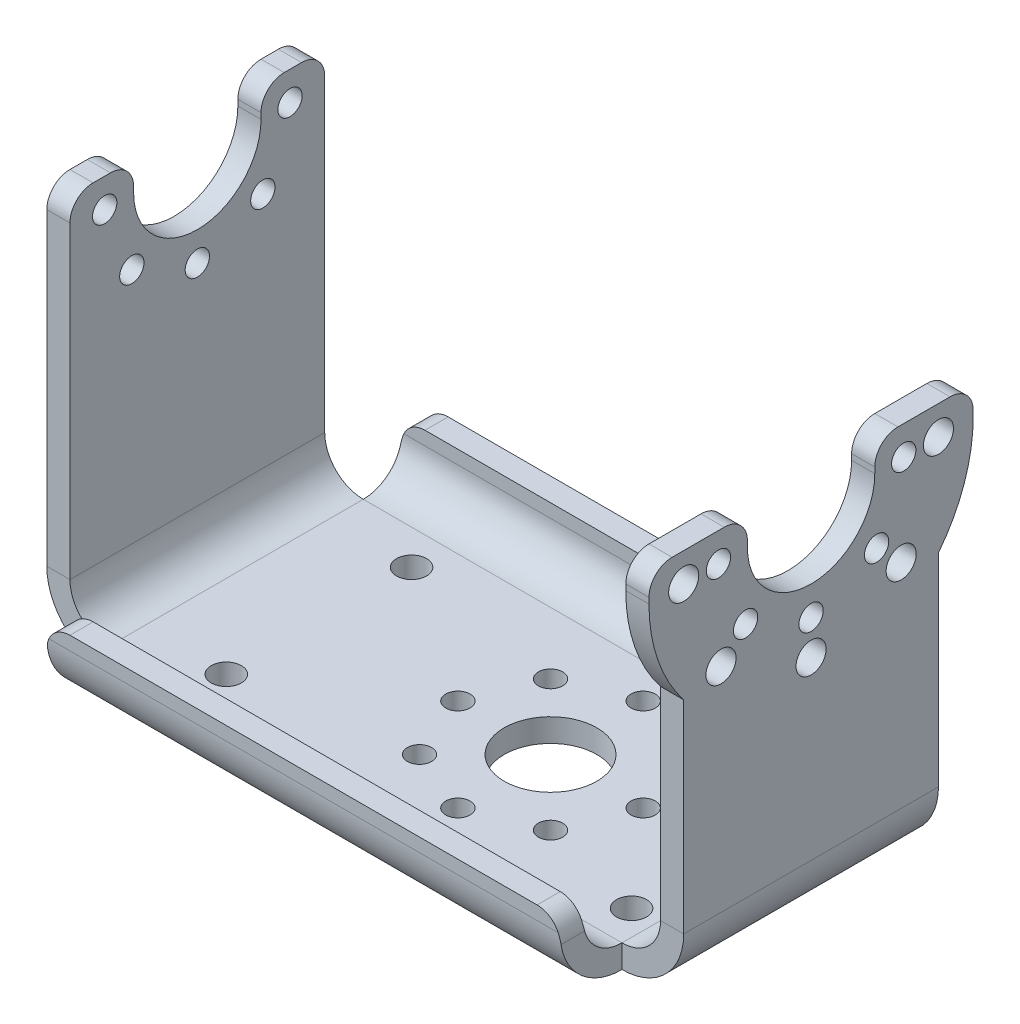
from build123d import *

# Parameters (mm, degrees)
BASE_FLANGE1_DEPTH      = 11
SKETCH5_R               = 4
SKETCH5_R_2             = 1.3
SKETCH5_R_3             = 1.05
CUT_EXTRUDE1_DEPTH      = 10
CUT_EXTRUDE2_DEPTH      = 45.273044847
CUT_EXTRUDE2_DEPTH_BACK = 45.273044847
SKETCH6_R               = 1.05
CUT_EXTRUDE3_DEPTH      = 10
FILLET1_R               = 2
EDGE_FLANGE1_DEPTH      = 44.34
FILLET2_R               = 2
FILLET2_OF_MIRROR1_R    = 2
BOSS_EXTRUDE2_DEPTH     = 2
FILLET4_R               = 2
SKETCH15_R              = 1.3
CUT_EXTRUDE5_DEPTH      = 2
CUT_EXTRUDE6_DEPTH      = 10
FILLET5_R               = 2


# Sheet-metal steps are written as plain solids
with BuildPart() as part:
    # Sketch1 → Base-Flange1 (new, symmetric)
    with BuildSketch(Plane.XY):
        with BuildLine():
            Line((-26.55, 32), (-26.55, 3.33))
            ThreePointArc((-26.55, 3.33), (-25.574665581, 0.975334419), (-23.22, 0))
            Line((-23.22, 0), (21.12, 0))
            ThreePointArc((21.12, 0), (23.474665581, 0.975334419), (24.45, 3.33))
            Line((24.45, 3.33), (24.45, 32))
            Line((24.45, 32), (26.45, 32))
            Line((26.45, 32), (26.45, 3.33))
            ThreePointArc((26.45, 3.33), (24.888879144, -0.438879144), (21.12, -2))
            Line((21.12, -2), (-23.22, -2))
            ThreePointArc((-23.22, -2), (-26.988879144, -0.438879144), (-28.55, 3.33))
            Line((-28.55, 3.33), (-28.55, 32))
            Line((-28.55, 32), (-26.55, 32))
        make_face()
    extrude(amount=BASE_FLANGE1_DEPTH, both=True)

    # Sketch5 → Cut-Extrude1 (cut)
    with BuildSketch(Plane(origin=(0, 0, 0), x_dir=(1, 0, 0), z_dir=(0, 1, 0))):
        with Locations(Location((3.95, 0, 0), (0, 0, 180))):
            Circle(SKETCH5_R)
        with Locations(Location((18.95, 8, 0), (0, 0, 180))):
            Circle(SKETCH5_R_2)
        with Locations(Location((18.95, -8, 0), (0, 0, 180))):
            Circle(SKETCH5_R_2)
        with Locations(Location((-16.05, -8, 0), (0, 0, 180))):
            Circle(SKETCH5_R_2)
        with Locations(Location((-16.05, 8, 0), (0, 0, 180))):
            Circle(SKETCH5_R_2)
        with Locations(Location((-4.05, 0, 0), (0, 0, 180))):
            Circle(SKETCH5_R_3)
        with Locations(Location((-1.706854249, 5.656854249, 0), (0, 0, 180))):
            Circle(SKETCH5_R_3)
        with Locations(Location((3.95, 8, 0), (0, 0, 180))):
            Circle(SKETCH5_R_3)
        with Locations(Location((9.606854249, 5.656854249, 0), (0, 0, 180))):
            Circle(SKETCH5_R_3)
        with Locations(Location((11.95, 0, 0), (0, 0, 180))):
            Circle(SKETCH5_R_3)
        with Locations(Location((9.606854249, -5.656854249, 0), (0, 0, 180))):
            Circle(SKETCH5_R_3)
        with Locations(Location((3.95, -8, 0), (0, 0, 180))):
            Circle(SKETCH5_R_3)
        with Locations(Location((-1.706854249, -5.656854249, 0), (0, 0, 180))):
            Circle(SKETCH5_R_3)
    extrude(amount=-CUT_EXTRUDE1_DEPTH, mode=Mode.SUBTRACT)

    # Sketch6 → Cut-Extrude2 (cut, two sides: drawn at the far end of the back side and taken through both)
    with BuildSketch(Plane(origin=(0, 0, 0), x_dir=(0, 0, -1), z_dir=(1, 0, 0)).offset(-CUT_EXTRUDE2_DEPTH_BACK)):
        with Locations((0, 21.5)):
            Circle(SKETCH6_R)
        with Locations((-5.656854249, 23.843145751)):
            Circle(SKETCH6_R)
        with Locations((-8, 29.5)):
            Circle(SKETCH6_R)
        with Locations((-5.656854249, 35.156854249)):
            Circle(SKETCH6_R)
        with Locations((0, 37.5)):
            Circle(SKETCH6_R)
        with Locations((5.656854249, 35.156854249)):
            Circle(SKETCH6_R)
        with Locations((8, 29.5)):
            Circle(SKETCH6_R)
        with Locations((5.656854249, 23.843145751)):
            Circle(SKETCH6_R)
        with BuildLine():
            Line((4.05, 32), (-4.05, 32))
            Line((-4.05, 32), (-4.05, 29.5))
            ThreePointArc((-4.05, 29.5), (0, 25.45), (4.05, 29.5))
            Line((4.05, 29.5), (4.05, 32))
        make_face()
    extrude(amount=CUT_EXTRUDE2_DEPTH + CUT_EXTRUDE2_DEPTH_BACK, mode=Mode.SUBTRACT)

    # Sketch7 → Cut-Extrude3 (cut)
    with BuildSketch(Plane.ZY.offset(28.55)):
        with BuildLine():
            Line((-5.5, 32), (5.5, 32))
            Line((5.5, 32), (5.5, 29.5))
            ThreePointArc((5.5, 29.5), (0, 24), (-5.5, 29.5))
            Line((-5.5, 29.5), (-5.5, 32))
        make_face()
    extrude(amount=-CUT_EXTRUDE3_DEPTH, mode=Mode.SUBTRACT)

    # Fillet1
    fillet1_edges = [part.edges().sort_by_distance(p)[0] for p in [
        (-27.55, 32, -11),
        (25.45, 32, -11),
        (-27.55, 32, -5.5),
        (-27.55, 32, 5.5),
        (-27.55, 32, 11),
        (25.45, 32, 11),
    ]]
    fillet(fillet1_edges, radius=FILLET1_R)

    # Edge-Flange1 section (across the edge) → Edge-Flange1 (add)
    with BuildSketch(Plane(origin=(-23.22, 0, 14.33), x_dir=(0, 0, -1), z_dir=(1, 0, 0))):
        with BuildLine():
            Line((-2, 3.33), (-2, 4.5))
            Line((-2, 4.5), (0, 4.5))
            Line((0, 4.5), (0, 3.33))
            ThreePointArc((0, 3.33), (0.975334419, 0.975334419), (3.33, 0))
            Line((3.33, 0), (3.33, -2))
            ThreePointArc((3.33, -2), (-0.438879144, -0.438879144), (-2, 3.33))
        make_face()
    edge_flange1 = extrude(amount=EDGE_FLANGE1_DEPTH)

    # Fillet2
    fillet2_edges = [part.edges().sort_by_distance(p)[0] for p in [
        (-23.22, 4.5, 15.33),
        (21.12, 4.5, 15.33),
    ]]
    fillet(fillet2_edges, radius=FILLET2_R)

    # Mirror1: Edge-Flange1 across plane
    add(edge_flange1.mirror(Plane.XY))

    # Fillet2 of Mirror1
    fillet2_of_mirror1_edges = [part.edges().sort_by_distance(p)[0] for p in [
        (-23.22, 4.5, -15.33),
        (21.12, 4.5, -15.33),
    ]]
    fillet(fillet2_of_mirror1_edges, radius=FILLET2_OF_MIRROR1_R)

    # Sketch14 → Boss-Extrude2 (add)
    with BuildSketch(Plane(origin=(26.45, 0, 0), x_dir=(0, 0, -1), z_dir=(1, 0, 0))):
        with BuildLine():
            Line((-11, 29.5), (-14, 29.5))
            ThreePointArc((-14, 29.5), (-13.228756555, 24.917424305), (-11, 20.839745962))
            Line((-11, 20.839745962), (-11, 29.5))
        make_face()
        with BuildLine():
            Line((-9.25, 29.5), (-11, 29.5))
            Line((-11, 29.5), (-11, 20.839745962))
            ThreePointArc((-11, 20.839745962), (0, 15.5), (11, 20.839745962))
            Line((11, 20.839745962), (11, 29.5))
            Line((11, 29.5), (9.25, 29.5))
            ThreePointArc((9.25, 29.5), (0, 20.25), (-9.25, 29.5))
        make_face()
        with BuildLine():
            Line((-14, 32), (-14, 29.5))
            Line((-14, 29.5), (-11, 29.5))
            Line((-11, 29.5), (-11, 30))
            ThreePointArc((-11, 30), (-10.414213562, 31.414213562), (-9, 32))
            Line((-9, 32), (-14, 32))
        make_face()
        with BuildLine():
            Line((-11, 30), (-11, 29.5))
            Line((-11, 29.5), (-9.25, 29.5))
            ThreePointArc((-9.25, 29.5), (-9.163535023, 30.761794708), (-8.905756565, 32))
            Line((-8.905756565, 32), (-9, 32))
            ThreePointArc((-9, 32), (-10.414213562, 31.414213562), (-11, 30))
        make_face()
        with BuildLine():
            Line((11, 29.5), (14, 29.5))
            Line((14, 29.5), (14, 32))
            Line((14, 32), (9, 32))
            ThreePointArc((9, 32), (10.414213562, 31.414213562), (11, 30))
            Line((11, 30), (11, 29.5))
        make_face()
        with BuildLine():
            Line((11, 29.5), (11, 20.839745962))
            ThreePointArc((11, 20.839745962), (13.228756555, 24.917424305), (14, 29.5))
            Line((14, 29.5), (11, 29.5))
        make_face()
        with BuildLine():
            ThreePointArc((8.905756565, 32), (9.163535023, 30.761794708), (9.25, 29.5))
            Line((9.25, 29.5), (11, 29.5))
            Line((11, 29.5), (11, 30))
            ThreePointArc((11, 30), (10.414213562, 31.414213562), (9, 32))
            Line((9, 32), (8.905756565, 32))
        make_face()
    extrude(amount=-BOSS_EXTRUDE2_DEPTH)

    # Fillet4
    fillet4_edges = [part.edges().sort_by_distance(p)[0] for p in [
        (25.45, 32, 14),
        (25.45, 32, -14),
    ]]
    fillet(fillet4_edges, radius=FILLET4_R)

    # Sketch15 → Cut-Extrude5 (cut)
    with BuildSketch(Plane(origin=(26.45, 0, 0), x_dir=(0, 0, -1), z_dir=(1, 0, 0))):
        with Locations((0, 18.5)):
            Circle(SKETCH15_R)
        with Locations((-7.778174593, 21.721825407)):
            Circle(SKETCH15_R)
        with Locations((-11, 29.5)):
            Circle(SKETCH15_R)
        with Locations((-7.778174593, 37.278174593)):
            Circle(SKETCH15_R)
        with Locations((0, 40.5)):
            Circle(SKETCH15_R)
        with Locations((7.778174593, 37.278174593)):
            Circle(SKETCH15_R)
        with Locations((11, 29.5)):
            Circle(SKETCH15_R)
        with Locations((7.778174593, 21.721825407)):
            Circle(SKETCH15_R)
    extrude(amount=-CUT_EXTRUDE5_DEPTH, mode=Mode.SUBTRACT)

    # Sketch16 → Cut-Extrude6 (cut)
    with BuildSketch(Plane.ZY.offset(-24.45)):
        with BuildLine():
            Line((-4.05, 29.5), (-5.5, 29.5))
            ThreePointArc((-5.5, 29.5), (0, 24), (5.5, 29.5))
            Line((5.5, 29.5), (4.05, 29.5))
            ThreePointArc((4.05, 29.5), (0, 25.45), (-4.05, 29.5))
        make_face()
        with BuildLine():
            Line((-4.05, 32), (-4.05, 29.5))
            Line((-4.05, 29.5), (4.05, 29.5))
            Line((4.05, 29.5), (4.05, 32))
            Line((4.05, 32), (4.898979486, 32))
            ThreePointArc((4.898979486, 32), (0, 35), (-4.898979486, 32))
            Line((-4.898979486, 32), (-4.05, 32))
        make_face()
        with BuildLine():
            ThreePointArc((-4.898979486, 32), (-5.347634392, 30.785615189), (-5.5, 29.5))
            Line((-5.5, 29.5), (-4.05, 29.5))
            Line((-4.05, 29.5), (-4.05, 32))
            Line((-4.05, 32), (-4.898979486, 32))
        make_face()
        with BuildLine():
            Line((-5.5, 32), (-5.5, 29.5))
            ThreePointArc((-5.5, 29.5), (-5.347634392, 30.785615189), (-4.898979486, 32))
            Line((-4.898979486, 32), (-5.5, 32))
        make_face()
        with BuildLine():
            Line((-5.5, 36.162581974), (-5.5, 32))
            Line((-5.5, 32), (-4.898979486, 32))
            ThreePointArc((-4.898979486, 32), (0, 35), (4.898979486, 32))
            Line((4.898979486, 32), (5.5, 32))
            Line((5.5, 32), (5.5, 36.162581974))
            Line((5.5, 36.162581974), (-5.5, 36.162581974))
        make_face()
        with BuildLine():
            Line((4.05, 29.5), (5.5, 29.5))
            ThreePointArc((5.5, 29.5), (5.347634392, 30.785615189), (4.898979486, 32))
            Line((4.898979486, 32), (4.05, 32))
            Line((4.05, 32), (4.05, 29.5))
        make_face()
        with BuildLine():
            ThreePointArc((4.898979486, 32), (5.347634392, 30.785615189), (5.5, 29.5))
            Line((5.5, 29.5), (5.5, 32))
            Line((5.5, 32), (4.898979486, 32))
        make_face()
    extrude(amount=-CUT_EXTRUDE6_DEPTH, mode=Mode.SUBTRACT)

    # Fillet5
    fillet5_edges = [part.edges().sort_by_distance(p)[0] for p in [
        (25.45, 32, 5.5),
        (25.45, 32, -5.5),
    ]]
    fillet(fillet5_edges, radius=FILLET5_R)


solid = part.part
